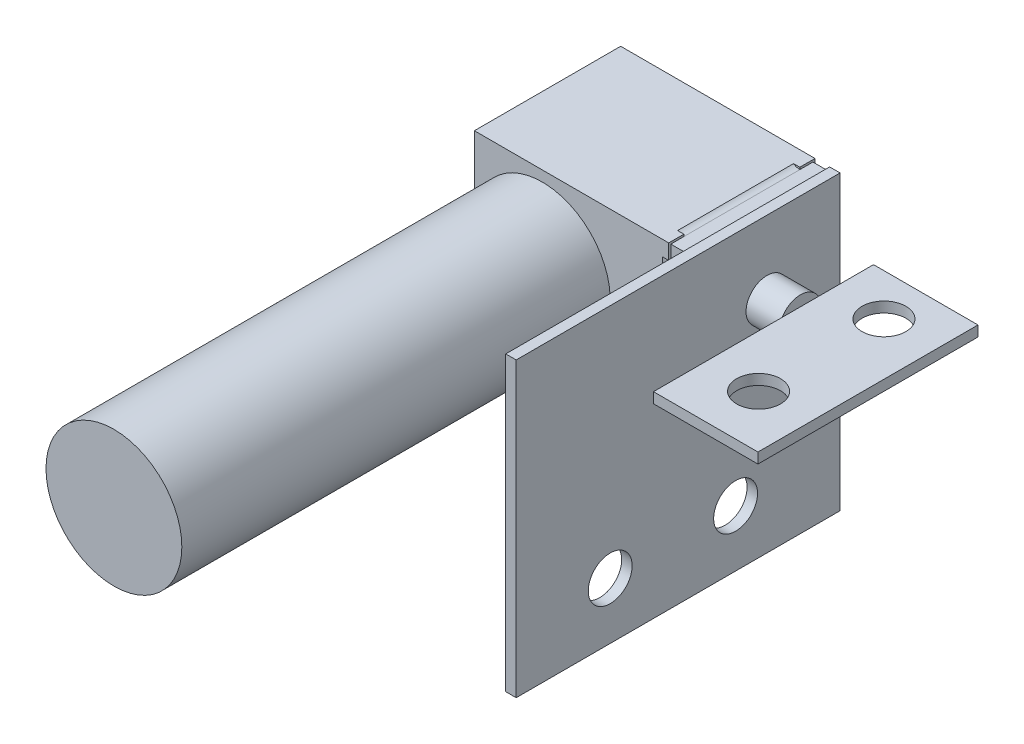
from build123d import *

# Parameters (mm, degrees)
SKETCH1_W            = 9
SKETCH1_H            = 7
BOSS_EXTRUDE1_DEPTH  = 7
SKETCH4_W            = 0.725
SKETCH4_H            = 0.725
BOSS_EXTRUDE3_DEPTH  = 0.3
SKETCH7_W            = 6.8
SKETCH7_H            = 1
BOSS_EXTRUDE5_DEPTH  = 1
FILLET1_R            = 0.5
SKETCH8_W            = 15.5
SKETCH8_H            = 14
BOSS_EXTRUDE6_DEPTH  = 0.5
EXTRUDE_9_DEPTH      = 10
EXTRUDE_9_DEPTH_BACK = 2.1
SKETCH_6_R           = 1
SKETCH10_W           = 10.53
SKETCH10_H           = 0.5
BOSS_EXTRUDE9_DEPTH  = 5
SKETCH_3_R           = 1.05
CUT_EXTRUDE_2_DEPTH  = 0.5
SKETCH_5_R           = 3.25
EXTRUDE_2_DEPTH      = 20.5
SKETCH_7_R           = 1.05
CUT_EXTRUDE_3_DEPTH  = 1.6


with BuildPart() as part:
    # Sketch1 → Boss-Extrude1 (new body)
    with BuildSketch(Plane(origin=(0, 0, 0), x_dir=(1, 0, 0), z_dir=(0, 1, 0))):
        Rectangle(SKETCH1_W, SKETCH1_H)
    extrude(amount=BOSS_EXTRUDE1_DEPTH)

    # Sketch4 → Boss-Extrude3 (add)
    with BuildSketch(Plane(origin=(4.5, 0, 0), x_dir=(0, 0, -1), z_dir=(1, 0, 0))):
        with Locations((-3.1375, 6.6375)):
            Rectangle(SKETCH4_W, SKETCH4_H)
        with Locations((3.1375, 6.6375)):
            Rectangle(SKETCH4_W, SKETCH4_H)
        with Locations((-3.1375, 0.3625)):
            Rectangle(SKETCH4_W, SKETCH4_H)
        with Locations((3.1375, 0.3625)):
            Rectangle(SKETCH4_W, SKETCH4_H)
    extrude(amount=BOSS_EXTRUDE3_DEPTH)

    # Sketch7 → Boss-Extrude5 (add)
    with BuildSketch(Plane(origin=(4.5, 0, 0), x_dir=(0, 0, -1), z_dir=(1, 0, 0))):
        with Locations((0, 0.6)):
            Rectangle(SKETCH7_W, SKETCH7_H)
        with Locations((0, 6.4)):
            Rectangle(SKETCH7_W, SKETCH7_H)
    extrude(amount=BOSS_EXTRUDE5_DEPTH)

    # Fillet1
    # the kernel refuses this fillet: 0.5 mm, written as the material it adds along each edge
    with BuildSketch(Plane(origin=(4.5, 6.9, 3.525), x_dir=(0, 1, 0), z_dir=(0, 0, -1))) as fillet1_piece_1_section:
        with BuildLine():
            CenterArc((0.5, 0.3), FILLET1_R, 180, 36.869897646)
            Line((0, 0.3), (0, 0))
            Line((0, 0), (0.1, 0))
        make_face()
    fillet1_piece_1 = extrude(amount=7.05, mode=Mode.PRIVATE)
    fillet1_piece_1 = split(fillet1_piece_1, bisect_by=Plane(origin=(4.5, 6.9, -3.4), z_dir=(0, 0, 1)), keep=Keep.TOP, mode=Mode.PRIVATE)
    fillet1_piece_1 = split(fillet1_piece_1, bisect_by=Plane(origin=(4.5, 6.9, 3.4), z_dir=(0, 0, -1)), keep=Keep.TOP, mode=Mode.PRIVATE)
    add(fillet1_piece_1)
    with BuildSketch(Plane(origin=(4.5, 5.9, 3.4), x_dir=(0, 0, 1), z_dir=(0, 1, 0))) as fillet1_piece_2:
        with BuildLine():
            CenterArc((0.5, 0.3), FILLET1_R, 180, 36.869897646)
            Line((0, 0.3), (0, 0))
            Line((0, 0), (0.1, 0))
        make_face()
    extrude(amount=0.375)
    with BuildSketch(Plane(origin=(4.5, 5.9, -3.4), x_dir=(0, -1, 0), z_dir=(0, 0, 1)), Plane(origin=(4.5, 1.1, 3.4), x_dir=(0, 1, 0), z_dir=(0, 0, -1))) as fillet1_piece_3:
        with BuildLine():
            CenterArc((FILLET1_R, FILLET1_R), FILLET1_R, 180, 90)
            Line((0, FILLET1_R), (0, 0))
            Line((0, 0), (FILLET1_R, 0))
        make_face()
    extrude(amount=6.8)
    with BuildSketch(Plane(origin=(4.5, 7.025, -3.4), x_dir=(0, 0, -1), z_dir=(0, -1, 0))) as fillet1_piece_4_section:
        with BuildLine():
            CenterArc((0.5, 0.3), FILLET1_R, 180, 36.869897646)
            Line((0, 0.3), (0, 0))
            Line((0, 0), (0.1, 0))
        make_face()
    fillet1_piece_4 = extrude(amount=1.125, mode=Mode.PRIVATE)
    fillet1_piece_4 = split(fillet1_piece_4, bisect_by=Plane(origin=(4.5, 6.9, -3.4), z_dir=(0, -1, 0)), keep=Keep.TOP, mode=Mode.PRIVATE)
    add(fillet1_piece_4)
    with BuildSketch(Plane(origin=(4.5, 1.1, -3.4), x_dir=(0, 0, -1), z_dir=(0, -1, 0))) as fillet1_piece_5_section:
        with BuildLine():
            CenterArc((0.5, 0.3), FILLET1_R, 180, 36.869897646)
            Line((0, 0.3), (0, 0))
            Line((0, 0), (0.1, 0))
        make_face()
    fillet1_piece_5 = extrude(amount=1.125, mode=Mode.PRIVATE)
    fillet1_piece_5 = split(fillet1_piece_5, bisect_by=Plane(origin=(4.5, 0.1, -3.4), z_dir=(0, 1, 0)), keep=Keep.TOP, mode=Mode.PRIVATE)
    add(fillet1_piece_5)
    with BuildSketch(Plane(origin=(4.5, -0.025, 3.4), x_dir=(0, 0, 1), z_dir=(0, 1, 0))) as fillet1_piece_6_section:
        with BuildLine():
            CenterArc((0.5, 0.3), FILLET1_R, 180, 36.869897646)
            Line((0, 0.3), (0, 0))
            Line((0, 0), (0.1, 0))
        make_face()
    fillet1_piece_6 = extrude(amount=1.125, mode=Mode.PRIVATE)
    fillet1_piece_6 = split(fillet1_piece_6, bisect_by=Plane(origin=(4.5, 0.1, 3.4), z_dir=(0, 1, 0)), keep=Keep.TOP, mode=Mode.PRIVATE)
    add(fillet1_piece_6)
    with BuildSketch(Plane(origin=(4.5, 0.1, -2.775), x_dir=(1, 0, 0), z_dir=(0, 0, 1))) as fillet1_piece_7:
        with BuildLine():
            CenterArc((0.3, -0.5), FILLET1_R, 90, 36.869897646)
            Line((0, -0.1), (0, 0))
            Line((0, 0), (0.3, 0))
        make_face()
    extrude(amount=5.55)
    with BuildSketch(Plane(origin=(4.5, 5.15, 3.4), x_dir=(0, 0, 1), z_dir=(0, 1, 0))) as fillet1_piece_8a_section:
        with BuildLine():
            CenterArc((0.5, 0.3), FILLET1_R, 180, 36.869897646)
            Line((0, 0.3), (0, 0))
            Line((0, 0), (0.1, 0))
        make_face()
    fillet1_piece_8a = extrude(amount=1.125, mode=Mode.PRIVATE)
    fillet1_piece_8a = split(fillet1_piece_8a, bisect_by=Plane(origin=(4.5, 5.9, 3.4), z_dir=(0, -1, 0)), keep=Keep.TOP, mode=Mode.PRIVATE)
    with BuildSketch(Plane(origin=(4.5, 5.9, -3.4), x_dir=(0, -1, 0), z_dir=(0, 0, 1))) as fillet1_piece_8b_section:
        with BuildLine():
            CenterArc((FILLET1_R, FILLET1_R), FILLET1_R, 180, 90)
            Line((0, FILLET1_R), (0, 0))
            Line((0, 0), (FILLET1_R, 0))
        make_face()
    fillet1_piece_8b = extrude(amount=8.05, mode=Mode.PRIVATE)
    fillet1_piece_8b = split(fillet1_piece_8b, bisect_by=Plane(origin=(4.5, 5.9, 3.5), z_dir=(0, 0, -1)), keep=Keep.TOP, mode=Mode.PRIVATE)
    fillet1_piece_8b = split(fillet1_piece_8b, bisect_by=Plane(origin=(4.5, 5.9, 3.4), z_dir=(0, 0, 1)), keep=Keep.TOP, mode=Mode.PRIVATE)
    fillet1_piece_8 = fillet1_piece_8a & fillet1_piece_8b
    add(fillet1_piece_8)
    with BuildSketch(Plane(origin=(4.5, 5.9, -4.65), x_dir=(0, -1, 0), z_dir=(0, 0, 1))) as fillet1_piece_9a_section:
        with BuildLine():
            CenterArc((FILLET1_R, FILLET1_R), FILLET1_R, 180, 90)
            Line((0, FILLET1_R), (0, 0))
            Line((0, 0), (FILLET1_R, 0))
        make_face()
    fillet1_piece_9a = extrude(amount=8.05, mode=Mode.PRIVATE)
    fillet1_piece_9a = split(fillet1_piece_9a, bisect_by=Plane(origin=(4.5, 5.9, -3.5), z_dir=(0, 0, 1)), keep=Keep.TOP, mode=Mode.PRIVATE)
    fillet1_piece_9a = split(fillet1_piece_9a, bisect_by=Plane(origin=(4.5, 5.9, -3.4), z_dir=(0, 0, -1)), keep=Keep.TOP, mode=Mode.PRIVATE)
    with BuildSketch(Plane(origin=(4.5, 6.275, -3.4), x_dir=(0, 0, -1), z_dir=(0, -1, 0))) as fillet1_piece_9b_section:
        with BuildLine():
            CenterArc((0.5, 0.3), FILLET1_R, 180, 36.869897646)
            Line((0, 0.3), (0, 0))
            Line((0, 0), (0.1, 0))
        make_face()
    fillet1_piece_9b = extrude(amount=1.125, mode=Mode.PRIVATE)
    fillet1_piece_9b = split(fillet1_piece_9b, bisect_by=Plane(origin=(4.5, 5.9, -3.4), z_dir=(0, -1, 0)), keep=Keep.TOP, mode=Mode.PRIVATE)
    fillet1_piece_9 = fillet1_piece_9a & fillet1_piece_9b
    add(fillet1_piece_9)
    with BuildSketch(Plane(origin=(4.5, 1.85, -3.4), x_dir=(0, 0, -1), z_dir=(0, -1, 0))) as fillet1_piece_10a_section:
        with BuildLine():
            CenterArc((0.5, 0.3), FILLET1_R, 180, 36.869897646)
            Line((0, 0.3), (0, 0))
            Line((0, 0), (0.1, 0))
        make_face()
    fillet1_piece_10a = extrude(amount=1.125, mode=Mode.PRIVATE)
    fillet1_piece_10a = split(fillet1_piece_10a, bisect_by=Plane(origin=(4.5, 1.1, -3.4), z_dir=(0, 1, 0)), keep=Keep.TOP, mode=Mode.PRIVATE)
    with BuildSketch(Plane(origin=(4.5, 1.1, 3.4), x_dir=(0, 1, 0), z_dir=(0, 0, -1))) as fillet1_piece_10b_section:
        with BuildLine():
            CenterArc((FILLET1_R, FILLET1_R), FILLET1_R, 180, 90)
            Line((0, FILLET1_R), (0, 0))
            Line((0, 0), (FILLET1_R, 0))
        make_face()
    fillet1_piece_10b = extrude(amount=8.05, mode=Mode.PRIVATE)
    fillet1_piece_10b = split(fillet1_piece_10b, bisect_by=Plane(origin=(4.5, 1.1, -3.5), z_dir=(0, 0, 1)), keep=Keep.TOP, mode=Mode.PRIVATE)
    fillet1_piece_10b = split(fillet1_piece_10b, bisect_by=Plane(origin=(4.5, 1.1, -3.4), z_dir=(0, 0, -1)), keep=Keep.TOP, mode=Mode.PRIVATE)
    fillet1_piece_10 = fillet1_piece_10a & fillet1_piece_10b
    add(fillet1_piece_10)
    with BuildSketch(Plane(origin=(4.5, 1.1, 4.65), x_dir=(0, 1, 0), z_dir=(0, 0, -1))) as fillet1_piece_11a_section:
        with BuildLine():
            CenterArc((FILLET1_R, FILLET1_R), FILLET1_R, 180, 90)
            Line((0, FILLET1_R), (0, 0))
            Line((0, 0), (FILLET1_R, 0))
        make_face()
    fillet1_piece_11a = extrude(amount=8.05, mode=Mode.PRIVATE)
    fillet1_piece_11a = split(fillet1_piece_11a, bisect_by=Plane(origin=(4.5, 1.1, 3.5), z_dir=(0, 0, -1)), keep=Keep.TOP, mode=Mode.PRIVATE)
    fillet1_piece_11a = split(fillet1_piece_11a, bisect_by=Plane(origin=(4.5, 1.1, 3.4), z_dir=(0, 0, 1)), keep=Keep.TOP, mode=Mode.PRIVATE)
    with BuildSketch(Plane(origin=(4.5, 0.725, 3.4), x_dir=(0, 0, 1), z_dir=(0, 1, 0))) as fillet1_piece_11b_section:
        with BuildLine():
            CenterArc((0.5, 0.3), FILLET1_R, 180, 36.869897646)
            Line((0, 0.3), (0, 0))
            Line((0, 0), (0.1, 0))
        make_face()
    fillet1_piece_11b = extrude(amount=1.125, mode=Mode.PRIVATE)
    fillet1_piece_11b = split(fillet1_piece_11b, bisect_by=Plane(origin=(4.5, 1.1, 3.4), z_dir=(0, 1, 0)), keep=Keep.TOP, mode=Mode.PRIVATE)
    fillet1_piece_11 = fillet1_piece_11a & fillet1_piece_11b
    add(fillet1_piece_11)

    # Sketch8 → Boss-Extrude6 (add)
    with BuildSketch(Plane(origin=(5.5, 0, 0), x_dir=(0, 0, -1), z_dir=(1, 0, 0))):
        with Locations((-4.25, 0)):
            Rectangle(SKETCH8_W, SKETCH8_H)
    extrude(amount=BOSS_EXTRUDE6_DEPTH)

    # ｽｹｯﾁ6 → ﾎﾞｽ - 押し出し9 (add, two sides: drawn at the far end of the back side and taken through both)
    with BuildSketch(Plane.ZY.offset(-5.5).offset(-EXTRUDE_9_DEPTH_BACK)):
        with Locations((0, 3.5)):
            Circle(SKETCH_6_R)
    extrude(amount=EXTRUDE_9_DEPTH + EXTRUDE_9_DEPTH_BACK)

    # Sketch10 → Boss-Extrude9 (add)
    with BuildSketch(Plane(origin=(7.6, 0, 0), x_dir=(0, 0, -1), z_dir=(1, 0, 0))):
        with Locations((-1.765, 3.75)):
            Rectangle(SKETCH10_W, SKETCH10_H)
    extrude(amount=BOSS_EXTRUDE9_DEPTH)

    # ｽｹｯﾁ3 → ｶｯﾄ - 押し出し2 (cut)
    with BuildSketch(Plane(origin=(6, 0, 0), x_dir=(0, 0, -1), z_dir=(1, 0, 0))):
        with Locations((-1.5, -4.3)):
            Circle(SKETCH_3_R)
        with Locations((-7.5, -4.3)):
            Circle(SKETCH_3_R)
    extrude(amount=-CUT_EXTRUDE_2_DEPTH, mode=Mode.SUBTRACT)

    # ｽｹｯﾁ5 → ﾎﾞｽ - 押し出し2 (add)
    with BuildSketch(Plane.XY.offset(3.5)):
        with Locations(Location((-1.25, 3.25, 0), (0, 0, 180))):
            Circle(SKETCH_5_R)
    extrude(amount=EXTRUDE_2_DEPTH)

    # ｽｹｯﾁ7 → ｶｯﾄ - 押し出し3 (cut)
    with BuildSketch(Plane(origin=(0, 3.5, 0), x_dir=(-1, 0, 0), z_dir=(0, -1, 0))):
        with Locations(Location((-10.1, -4.5, 0), (0, 0, 90))):
            Circle(SKETCH_7_R)
        with Locations(Location((-10.1, 1.5, 0), (0, 0, 90))):
            Circle(SKETCH_7_R)
    extrude(amount=-CUT_EXTRUDE_3_DEPTH, mode=Mode.SUBTRACT)


solid = part.part
